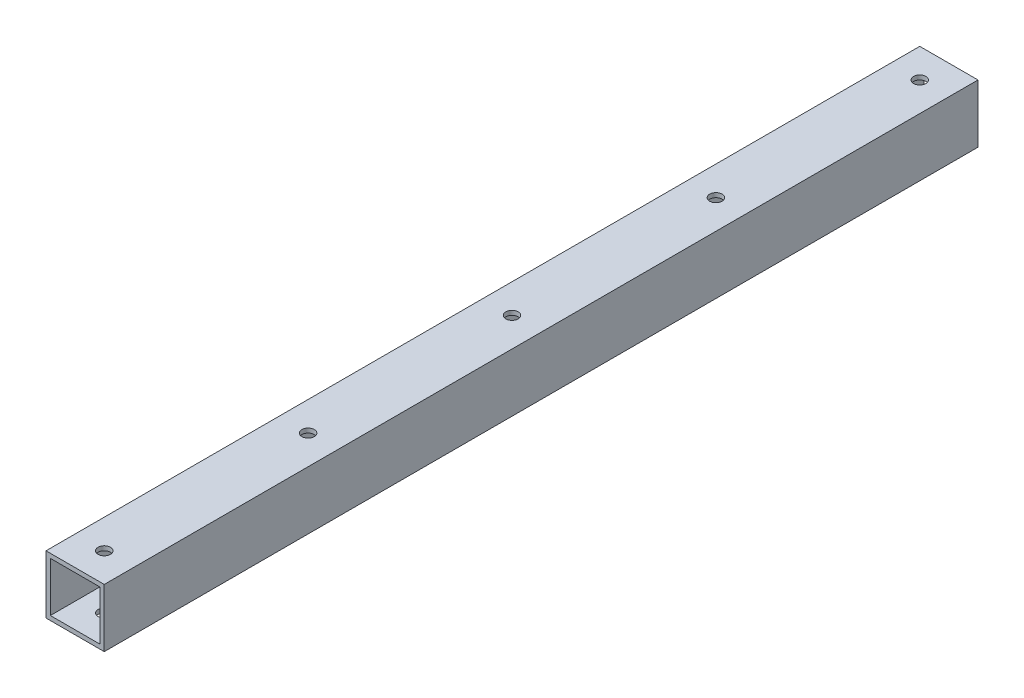
from build123d import *

# Parameters (mm, degrees)
SKETCH1_W           = 20
SKETCH1_H           = 20
SKETCH1_W_2         = 17
SKETCH1_H_2         = 17
BOSS_EXTRUDE1_DEPTH = 300
SKETCH2_R           = 2.125
CUT_EXTRUDE1_DEPTH  = 301.83217913


with BuildPart() as part:
    # Sketch1 → Boss-Extrude1 (new body)
    with BuildSketch(Plane.XY):
        Rectangle(SKETCH1_W, SKETCH1_H)
        Rectangle(SKETCH1_W_2, SKETCH1_H_2, mode=Mode.SUBTRACT)
    extrude(amount=-BOSS_EXTRUDE1_DEPTH)

    # Sketch2 → Cut-Extrude1 (cut, through all)
    with BuildSketch(Plane(origin=(0, 10, 0), x_dir=(1, 0, 0), z_dir=(0, 1, 0))):
        with Locations((0, 10)):
            Circle(SKETCH2_R)
        with Locations((0, 80)):
            Circle(SKETCH2_R)
        with Locations((0, 150)):
            Circle(SKETCH2_R)
        with Locations((0, 220)):
            Circle(SKETCH2_R)
        with Locations((0, 290)):
            Circle(SKETCH2_R)
    extrude(amount=-CUT_EXTRUDE1_DEPTH, mode=Mode.SUBTRACT)


solid = part.part
